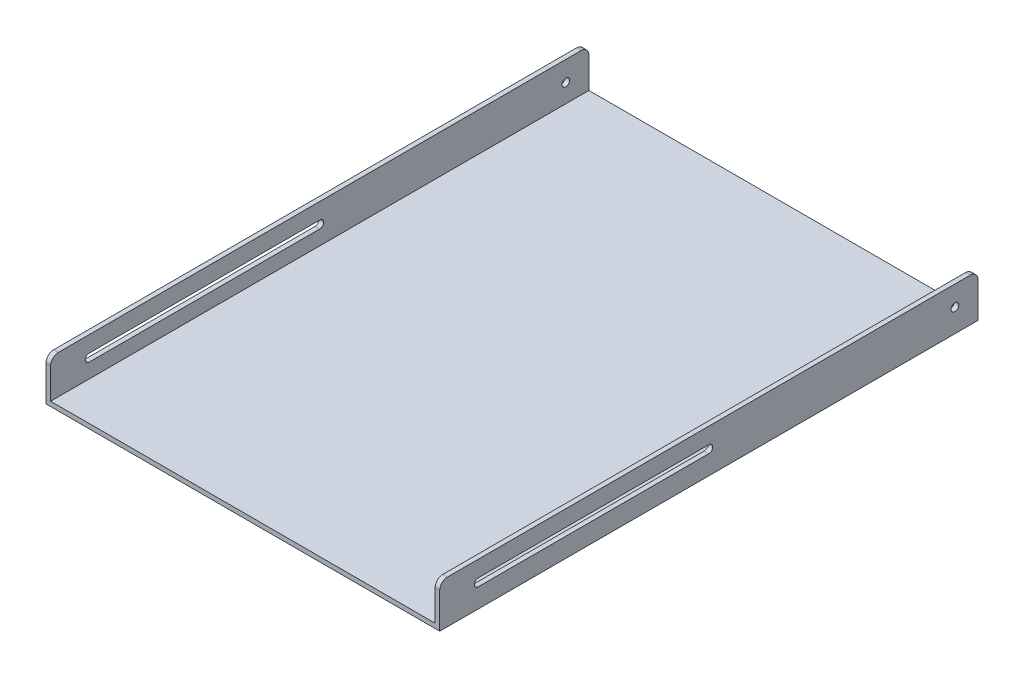
from build123d import *

# Parameters (mm, degrees)
EXTRUDE_THIN1_DEPTH = 350
SKETCH2_R           = 5
CUT_EXTRUDE1_DEPTH  = 623.208968113
FILLET1_R           = 10


with BuildPart() as part:
    # Sketch1 → Extrude-Thin1 (new, symmetric)
    with BuildSketch(Plane.XY):
        Polygon((-250, 50), (-250, 0), (250, 0), (250, 50), (256, 50), (256, -6), (-256, -6), (-256, 50), align=None)
    extrude(amount=EXTRUDE_THIN1_DEPTH, both=True)

    # Sketch2 → Cut-Extrude1 (cut, through all)
    with BuildSketch(Plane(origin=(256, 0, 0), x_dir=(0, 0, -1), z_dir=(1, 0, 0))):
        with Locations((320, 24)):
            Circle(SKETCH2_R)
        with BuildLine():
            Line((-300, 29), (0, 29))
            ThreePointArc((0, 29), (5, 24), (0, 19))
            Line((0, 19), (-300, 19))
            ThreePointArc((-300, 19), (-305, 24), (-300, 29))
        make_face()
    extrude(amount=-CUT_EXTRUDE1_DEPTH, mode=Mode.SUBTRACT)

    # Fillet1
    fillet1_edges = [part.edges().sort_by_distance(p)[0] for p in [
        (253, 50, 350),
        (-253, 50, 350),
        (-253, 50, -350),
        (253, 50, -350),
    ]]
    fillet(fillet1_edges, radius=FILLET1_R)


solid = part.part
